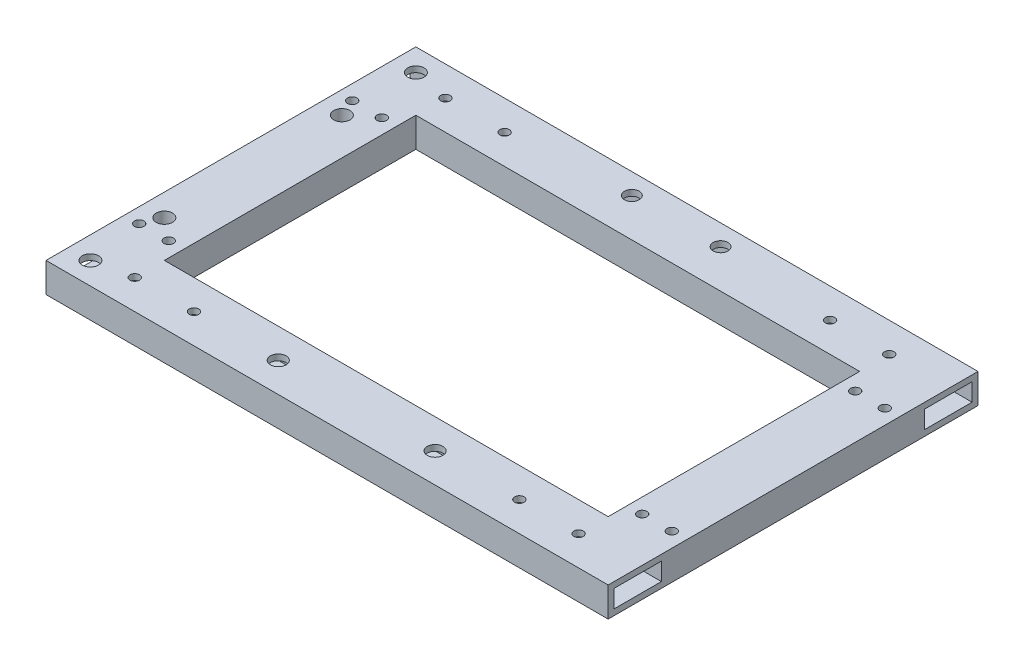
from build123d import *

# Parameters (mm, degrees)
SKETCH1_W          = 190
SKETCH1_H          = 125
SKETCH1_W_2        = 150
SKETCH1_H_2        = 85
EXTRUDE1_DEPTH     = 10
SKETCH2_W          = 16
SKETCH2_H          = 6
CUT_EXTRUDE1_DEPTH = 200
SKETCH3_R          = 1.6
SKETCH3_R_2        = 2.65
SKETCH3_R_3        = 2.5
CUT_EXTRUDE2_DEPTH = 20
SKETCH4_R          = 1.6
CUT_EXTRUDE3_DEPTH = 26
SKETCH5_R          = 2.75
CUT_EXTRUDE4_DEPTH = 10


with BuildPart() as part:
    # Sketch1 → Extrude1 (new body)
    with BuildSketch(Plane(origin=(0, 0, 0), x_dir=(1, 0, 0), z_dir=(0, 1, 0))):
        Rectangle(SKETCH1_W, SKETCH1_H)
        Rectangle(SKETCH1_W_2, SKETCH1_H_2, mode=Mode.SUBTRACT)
    extrude(amount=EXTRUDE1_DEPTH)

    # Sketch2 → Cut-Extrude1 (cut)
    with BuildSketch(Plane.ZY.offset(95)):
        with Locations((-52.5, 5)):
            Rectangle(SKETCH2_W, SKETCH2_H)
        with Locations((52.5, 5)):
            Rectangle(SKETCH2_W, SKETCH2_H)
    extrude(amount=-CUT_EXTRUDE1_DEPTH, mode=Mode.SUBTRACT)

    # Sketch3 → Cut-Extrude2 (cut)
    with BuildSketch(Plane(origin=(0, 10, 0), x_dir=(1, 0, 0), z_dir=(0, 1, 0))):
        with Locations((75, -52.5)):
            Circle(SKETCH3_R)
        with Locations((55, -52.5)):
            Circle(SKETCH3_R)
        with Locations((75, 52.5)):
            Circle(SKETCH3_R)
        with Locations((55, 52.5)):
            Circle(SKETCH3_R)
        with Locations((-55, 52.5)):
            Circle(SKETCH3_R)
        with Locations((-75, 52.5)):
            Circle(SKETCH3_R)
        with Locations((-75, -52.5)):
            Circle(SKETCH3_R)
        with Locations((-55, -52.5)):
            Circle(SKETCH3_R)
        with Locations((26.5, -52.5)):
            Circle(SKETCH3_R_2)
        with Locations((-26.5, -52.5)):
            Circle(SKETCH3_R_2)
        with Locations((15, 55.5)):
            Circle(SKETCH3_R_3)
        with Locations((-15, 55.5)):
            Circle(SKETCH3_R_3)
    extrude(amount=-CUT_EXTRUDE2_DEPTH, mode=Mode.SUBTRACT)

    # Sketch4 → Cut-Extrude3 (cut)
    with BuildSketch(Plane(origin=(0, 13, 0), x_dir=(1, 0, 0), z_dir=(0, 1, 0))):
        with Locations((90, 36)):
            Circle(SKETCH4_R)
        with Locations((80, 36)):
            Circle(SKETCH4_R)
        with Locations((90, -36)):
            Circle(SKETCH4_R)
        with Locations((80, -36)):
            Circle(SKETCH4_R)
        with Locations((-80, -36)):
            Circle(SKETCH4_R)
        with Locations((-90, -36)):
            Circle(SKETCH4_R)
        with Locations((-80, 36)):
            Circle(SKETCH4_R)
        with Locations((-90, 36)):
            Circle(SKETCH4_R)
    extrude(amount=-CUT_EXTRUDE3_DEPTH, mode=Mode.SUBTRACT)

    # Sketch5 → Cut-Extrude4 (cut)
    with BuildSketch(Plane(origin=(0, 10, 0), x_dir=(1, 0, 0), z_dir=(0, 1, 0))):
        with Locations((-87.5, -55)):
            Circle(SKETCH5_R)
        with Locations((-87.5, -30)):
            Circle(SKETCH5_R)
        with Locations((-87.5, 30)):
            Circle(SKETCH5_R)
        with Locations((-87.5, 55)):
            Circle(SKETCH5_R)
    extrude(amount=-CUT_EXTRUDE4_DEPTH, mode=Mode.SUBTRACT)


solid = part.part
